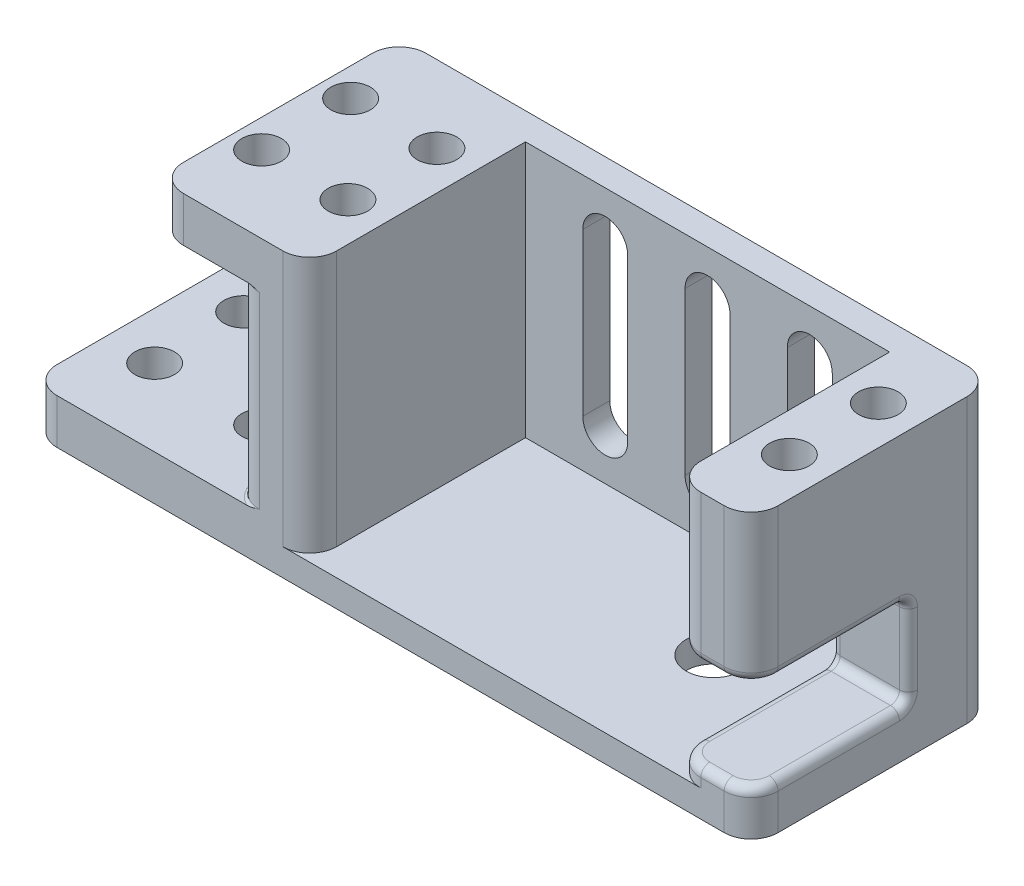
from build123d import *

# Parameters (mm, degrees)
SKETCH1_W           = 8.6
SKETCH1_H           = 27
BOSS_EXTRUDE1_DEPTH = 31.5
SKETCH2_W           = 27
SKETCH2_H           = 3
BOSS_EXTRUDE2_DEPTH = 40.5
SKETCH3_W           = 3
SKETCH3_H           = 28.5
BOSS_EXTRUDE3_DEPTH = 40.5
SKETCH4_W           = 8.6
SKETCH4_H           = 27
BOSS_EXTRUDE4_DEPTH = 31.5
CUT_EXTRUDE8_DEPTH  = 10
FILLET1_R           = 3
SKETCH5_R           = 2.2
CUT_EXTRUDE1_DEPTH  = 5
SKETCH6_W           = 17.5
SKETCH6_H           = 10
CUT_EXTRUDE2_DEPTH  = 10
FILLET3_R           = 1
SKETCH9_W           = 27
SKETCH9_H           = 5
BOSS_EXTRUDE5_DEPTH = 22.5
SKETCH10_R          = 2.2
CUT_EXTRUDE5_DEPTH  = 100
FILLET4_R           = 3
FILLET5_R           = 0.3
SKETCH12_W          = 14.05
SKETCH12_H          = 27
CUT_EXTRUDE6_DEPTH  = 10
FILLET6_R           = 3
SKETCH13_R          = 3.05
CUT_EXTRUDE7_DEPTH  = 10


with BuildPart() as part:
    # Sketch1 → Boss-Extrude1 (new body)
    with BuildSketch(Plane(origin=(0, 0, 0), x_dir=(1, 0, 0), z_dir=(0, 1, 0))):
        with Locations((4.3, 0)):
            Rectangle(SKETCH1_W, SKETCH1_H)
    extrude(amount=BOSS_EXTRUDE1_DEPTH)

    # Sketch2 → Boss-Extrude2 (add)
    with BuildSketch(Plane(origin=(8.6, 0, 0), x_dir=(0, 0, -1), z_dir=(1, 0, 0))):
        with Locations((0, 1.5)):
            Rectangle(SKETCH2_W, SKETCH2_H)
    extrude(amount=BOSS_EXTRUDE2_DEPTH)

    # Sketch3 → Boss-Extrude3 (add)
    with BuildSketch(Plane(origin=(8.6, 0, 0), x_dir=(0, 0, -1), z_dir=(1, 0, 0))):
        with Locations((12, 17.25)):
            Rectangle(SKETCH3_W, SKETCH3_H)
    extrude(amount=BOSS_EXTRUDE3_DEPTH)

    # Sketch4 → Boss-Extrude4 (add)
    with BuildSketch(Plane(origin=(0, 31.5, 0), x_dir=(1, 0, 0), z_dir=(0, 1, 0))):
        with Locations((53.4, 0)):
            Rectangle(SKETCH4_W, SKETCH4_H)
    extrude(amount=-BOSS_EXTRUDE4_DEPTH)

    # Sketch15 → Cut-Extrude8 (cut)
    with BuildSketch(Plane.XY.offset(-10.5)):
        with BuildLine():
            Line((31.35, 8.25), (31.35, 26.25))
            ThreePointArc((31.35, 26.25), (28.85, 28.75), (26.35, 26.25))
            Line((26.35, 26.25), (26.35, 8.25))
            ThreePointArc((26.35, 8.25), (28.85, 5.75), (31.35, 8.25))
        make_face()
        with BuildLine():
            Line((42.725, 8.25), (42.725, 26.25))
            ThreePointArc((42.725, 26.25), (40.225, 28.75), (37.725, 26.25))
            Line((37.725, 26.25), (37.725, 8.25))
            ThreePointArc((37.725, 8.25), (40.225, 5.75), (42.725, 8.25))
        make_face()
        with BuildLine():
            Line((19.975, 8.25), (19.975, 26.25))
            ThreePointArc((19.975, 26.25), (17.475, 28.75), (14.975, 26.25))
            Line((14.975, 26.25), (14.975, 8.25))
            ThreePointArc((14.975, 8.25), (17.475, 5.75), (19.975, 8.25))
        make_face()
    extrude(amount=-CUT_EXTRUDE8_DEPTH, mode=Mode.SUBTRACT)

    # Fillet1
    fillet1_edges = [part.edges().sort_by_distance(p)[0] for p in [
        (57.7, 15.75, -13.5),
        (57.7, 15.75, 13.5),
        (49.1, 17.25, 13.5),
        (8.6, 17.25, 13.5),
    ]]
    fillet(fillet1_edges, radius=FILLET1_R)

    # Sketch5 → Cut-Extrude1 (cut)
    with BuildSketch(Plane(origin=(0, 31.5, 0), x_dir=(1, 0, 0), z_dir=(0, 1, 0))):
        with Locations(Location((53.4, 4.95, 0), (0, 0, 270))):
            Circle(SKETCH5_R)
        with Locations(Location((53.4, -4.95, 0), (0, 0, 270))):
            Circle(SKETCH5_R)
        with Locations(Location((4.3, 4.95, 0), (0, 0, 270))):
            Circle(SKETCH5_R)
        with Locations(Location((4.3, -4.95, 0), (0, 0, 270))):
            Circle(SKETCH5_R)
    extrude(amount=-CUT_EXTRUDE1_DEPTH, mode=Mode.SUBTRACT)

    # Sketch6 → Cut-Extrude2 (cut)
    with BuildSketch(Plane.ZY.offset(-49.1)):
        with Locations((4.75, 10)):
            Rectangle(SKETCH6_W, SKETCH6_H)
    extrude(amount=-CUT_EXTRUDE2_DEPTH, mode=Mode.SUBTRACT)

    # Fillet3
    fillet3_edges = [part.edges().sort_by_distance(p)[0] for p in [
        (56.821320344, 5, 12.621320344),
        (56.821320344, 15, 12.621320344),
        (57.7, 10, -4),
        (49.1, 5, 3.25),
        (49.1, 15, 3.25),
        (49.1, 10, -4),
        (49.978679656, 15, 12.621320344),
        (57.7, 15, 3.25),
        (53.4, 15, 13.5),
        (49.978679656, 5, 12.621320344),
        (57.7, 5, 3.25),
        (53.4, 15, -4),
        (53.4, 5, 13.5),
        (53.4, 5, -4),
    ]]
    fillet(fillet3_edges, radius=FILLET3_R)

    # Sketch9 → Boss-Extrude5 (add)
    with BuildSketch(Plane.ZY):
        with Locations((0, 29)):
            Rectangle(SKETCH9_W, SKETCH9_H)
        with Locations((0, 2.5)):
            Rectangle(SKETCH9_W, SKETCH9_H)
    extrude(amount=BOSS_EXTRUDE5_DEPTH)

    # Sketch10 → Cut-Extrude5 (cut)
    with BuildSketch(Plane(origin=(0, 31.5, 0), x_dir=(1, 0, 0), z_dir=(0, 1, 0))):
        with Locations(Location((-5.3, 4.95, 0), (0, 0, 90))):
            Circle(SKETCH10_R)
        with Locations(Location((-5.3, -4.95, 0), (0, 0, 90))):
            Circle(SKETCH10_R)
        with Locations(Location((-17.2, -4.95, 0), (0, 0, 90))):
            Circle(SKETCH10_R)
        with Locations(Location((-17.2, 4.95, 0), (0, 0, 90))):
            Circle(SKETCH10_R)
    extrude(amount=-CUT_EXTRUDE5_DEPTH, mode=Mode.SUBTRACT)

    # Fillet4
    fillet4_edges = [part.edges().sort_by_distance(p)[0] for p in [
        (0, 15.75, 13.5),
        (0, 15.75, -13.5),
        (-22.5, 2.5, 13.5),
        (-22.5, 2.5, -13.5),
    ]]
    fillet(fillet4_edges, radius=FILLET4_R)

    # Fillet5
    # the kernel refuses this fillet: 0.3 mm, written as the material it adds along each edge
    with BuildSketch(Plane(origin=(0, 5, 10.5), x_dir=(0, 1, 0), z_dir=(0, 0, -1))) as fillet5_piece_1:
        with BuildLine():
            CenterArc((FILLET5_R, -FILLET5_R), FILLET5_R, 90, 90)
            Line((0, -FILLET5_R), (0, 0))
            Line((0, 0), (FILLET5_R, 0))
        make_face()
    extrude(amount=21)
    with BuildSketch(Plane(origin=(0, 26.5, 10.5), x_dir=(0, -1, 0), z_dir=(0, 0, -1))) as fillet5_piece_2:
        with BuildLine():
            CenterArc((FILLET5_R, FILLET5_R), FILLET5_R, 180, 90)
            Line((0, FILLET5_R), (0, 0))
            Line((0, 0), (FILLET5_R, 0))
        make_face()
    extrude(amount=21)
    with BuildSketch(Plane(origin=(3, 5, -10.5), x_dir=(-1, 0, 0), z_dir=(0, 0, 1))) as fillet5_piece_3_section:
        with BuildLine():
            CenterArc((3 + FILLET5_R, -FILLET5_R), FILLET5_R, 90, 90)
            Line((3 + FILLET5_R, 0), (3, 0))
            Line((3, 0), (3, -FILLET5_R))
        make_face()
    fillet5_piece_3 = revolve(axis=Axis((3, 5, -10.5), (0, -1, 0)), revolution_arc=104.329698924, mode=Mode.PRIVATE)
    fillet5_piece_3 = split(fillet5_piece_3, bisect_by=Plane(origin=(0.81861369, 5.084946104, -13.5), z_dir=(0, 0, 1)), keep=Keep.TOP, mode=Mode.PRIVATE)
    add(fillet5_piece_3)
    with BuildSketch(Plane(origin=(3, 26.5, -10.5), x_dir=(-1, 0, 0), z_dir=(0, 0, 1))) as fillet5_piece_4_section:
        with BuildLine():
            CenterArc((3 + FILLET5_R, FILLET5_R), FILLET5_R, 180, 90)
            Line((3 + FILLET5_R, 0), (3, 0))
            Line((3, 0), (3, FILLET5_R))
        make_face()
    fillet5_piece_4 = revolve(axis=Axis((3, 26.5, -10.5), (0, -1, 0)), revolution_arc=104.329698924, mode=Mode.PRIVATE)
    fillet5_piece_4 = split(fillet5_piece_4, bisect_by=Plane(origin=(0.81861369, 26.415053896, -13.5), z_dir=(0, 0, 1)), keep=Keep.TOP, mode=Mode.PRIVATE)
    add(fillet5_piece_4)
    with BuildSketch(Plane(origin=(3, 5, 10.5), x_dir=(0.24750126301206385, 0, 0.968887570777659), z_dir=(0.968887570777659, 0, -0.24750126301206385))) as fillet5_piece_5_section:
        with BuildLine():
            CenterArc((3 + FILLET5_R, -FILLET5_R), FILLET5_R, 90, 90)
            Line((3 + FILLET5_R, 0), (3, 0))
            Line((3, 0), (3, -FILLET5_R))
        make_face()
    fillet5_piece_5 = revolve(axis=Axis((3, 5, 10.5), (0, -1, 0)), revolution_arc=104.329698924, mode=Mode.PRIVATE)
    fillet5_piece_5 = split(fillet5_piece_5, bisect_by=Plane(origin=(0.818613701, 5.084946089, 13.5), z_dir=(0, 0, -1)), keep=Keep.TOP, mode=Mode.PRIVATE)
    add(fillet5_piece_5)
    with BuildSketch(Plane(origin=(3, 26.5, 10.5), x_dir=(0.24750126301206454, 0, 0.9688875707776589), z_dir=(0.9688875707776589, 0, -0.24750126301206454))) as fillet5_piece_6_section:
        with BuildLine():
            CenterArc((3 + FILLET5_R, FILLET5_R), FILLET5_R, 180, 90)
            Line((3, FILLET5_R), (3, 0))
            Line((3, 0), (3 + FILLET5_R, 0))
        make_face()
    fillet5_piece_6 = revolve(axis=Axis((3, 26.5, 10.5), (0, -1, 0)), revolution_arc=104.329698924, mode=Mode.PRIVATE)
    fillet5_piece_6 = split(fillet5_piece_6, bisect_by=Plane(origin=(0.818613746, 26.41505391, 13.5), z_dir=(0, 0, -1)), keep=Keep.TOP, mode=Mode.PRIVATE)
    add(fillet5_piece_6)

    # Sketch12 → Cut-Extrude6 (cut)
    with BuildSketch(Plane(origin=(0, 31.5, 0), x_dir=(1, 0, 0), z_dir=(0, 1, 0))):
        with Locations((-15.475, 0)):
            Rectangle(SKETCH12_W, SKETCH12_H)
    extrude(amount=-CUT_EXTRUDE6_DEPTH, mode=Mode.SUBTRACT)

    # Fillet6
    fillet6_edges = [part.edges().sort_by_distance(p)[0] for p in [
        (-8.45, 29, -13.5),
        (-8.45, 29, 13.5),
    ]]
    fillet(fillet6_edges, radius=FILLET6_R)

    # Sketch13 → Cut-Extrude7 (cut)
    with BuildSketch(Plane.XZ):
        with Locations(Location((40.02, 0, 0), (0, 0, 270))):
            Circle(SKETCH13_R)
    extrude(amount=-CUT_EXTRUDE7_DEPTH, mode=Mode.SUBTRACT)


solid = part.part
